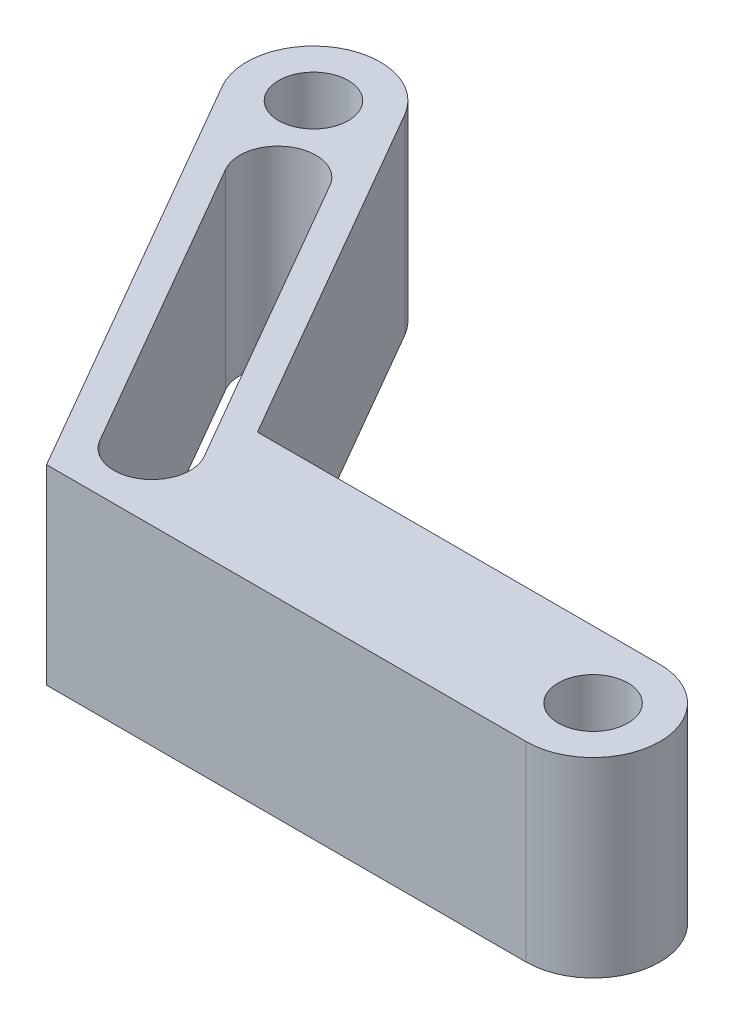
from build123d import *

# Parameters (mm, degrees)
SKIZZE2_R                       = 1.825
AUFSATZ_LINEAR_AUSTRAGEN1_DEPTH = 10
SCHNITT_LINEAR_AUSTRAGEN1_DEPTH = 46.901929296


with BuildPart() as part:
    # Skizze2 → Aufsatz-Linear austragen1 (new body)
    with BuildSketch(Plane(origin=(0, 0, 0), x_dir=(1, 0, 0), z_dir=(0, 1, 0))):
        with BuildLine():
            Line((0, 3.5), (-21.073284825, 3.5))
            Line((-21.073284825, 3.5), (-31.609927238, 21.75))
            ThreePointArc((-31.609927238, 21.75), (-36.391016151, 23.031088913), (-37.672105065, 18.25))
            Line((-37.672105065, 18.25), (-25.11473671, -3.5))
            Line((-25.11473671, -3.5), (0, -3.5))
            ThreePointArc((0, -3.5), (3.5, 0), (0, 3.5))
        make_face()
        with Locations((-34.641016151, 20)):
            Circle(SKIZZE2_R, mode=Mode.SUBTRACT)
        Circle(SKIZZE2_R, mode=Mode.SUBTRACT)
    extrude(amount=AUFSATZ_LINEAR_AUSTRAGEN1_DEPTH)

    # Skizze4 → Schnitt-Linear austragen1 (cut, through all)
    with BuildSketch(Plane(origin=(0, 10, 0), x_dir=(1, 0, 0), z_dir=(0, 1, 0))):
        with BuildLine():
            Line((-30.36195996, 16.588457268), (-21.36195996, 1))
            ThreePointArc((-21.36195996, 1), (-22.094010768, -1.732050808), (-24.826061575, -1))
            Line((-24.826061575, -1), (-33.826061575, 14.588457268))
            ThreePointArc((-33.826061575, 14.588457268), (-33.094010768, 17.320508076), (-30.36195996, 16.588457268))
        make_face()
    extrude(amount=-SCHNITT_LINEAR_AUSTRAGEN1_DEPTH, mode=Mode.SUBTRACT)


solid = part.part
